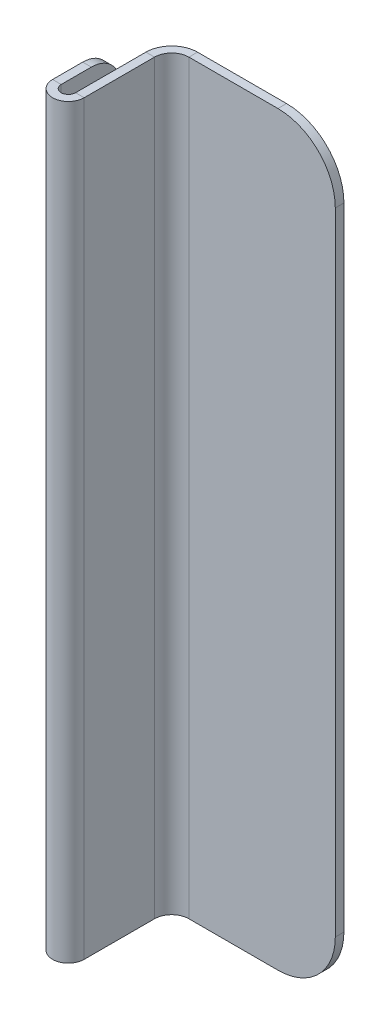
from build123d import *

# Parameters (mm, degrees)
IZIM1_W                      = 30
IZIM1_H                      = 130
TABAN_FLAN_1_DEPTH           = 1.5
RADYUS1_R                    = 10
KENAR_FLAN_1_STRIP_W         = 12
KENAR_FLAN_1_STRIP_H         = 1.5
KENAR_FLAN_1_STRIP_CUT_DEPTH = 130
KENAR_FLAN_1_DEPTH           = 130
KENAR_START                  = -53.051470588
KENAR_EKME1_DEPTH            = 130
KENAR_EKME1_2_DEPTH          = 130
RADYUS2_R                    = 5


# Read off the part's stored shape, not the designer's step: Kenar Çekme1
# Sheet-metal steps are written as plain solids
with BuildPart() as part:
    # Çizim1 → Taban-Flanş1 (new body)
    with BuildSketch(Plane.XY):
        with Locations((-32.781930006, 11.948529412)):
            Rectangle(IZIM1_W, IZIM1_H)
    extrude(amount=-TABAN_FLAN_1_DEPTH)

    # Radyus1
    radyus1_edges = [part.edges().sort_by_distance(p)[0] for p in [
        (-17.781930006, 76.948529412, -0.75),
        (-17.781930006, -53.051470588, -0.75),
    ]]
    fillet(radyus1_edges, radius=RADYUS1_R)

    # Kenar-Flanş1 strip (across the edge) → Kenar-Flanş1 strip cut (cut)
    with BuildSketch(Plane(origin=(-47.781930006, 76.948529412, 0), x_dir=(1, 0, 0), z_dir=(0, -1, 0))):
        with Locations((-1.5, -0.75)):
            Rectangle(KENAR_FLAN_1_STRIP_W, KENAR_FLAN_1_STRIP_H)
    extrude(amount=KENAR_FLAN_1_STRIP_CUT_DEPTH, mode=Mode.SUBTRACT)

    # Kenar-Flanş1 section (across the edge) → Kenar-Flanş1 (add)
    with BuildSketch(Plane(origin=(-47.781930006, 76.948529412, 0), x_dir=(1, 0, 0), z_dir=(0, -1, 0))):
        with BuildLine():
            Line((0, 3), (0, 18))
            Line((0, 18), (1.5, 18))
            Line((1.5, 18), (1.5, 3))
            ThreePointArc((1.5, 3), (2.378679656, 0.878679656), (4.5, 0))
            Line((4.5, 0), (4.5, -1.5))
            ThreePointArc((4.5, -1.5), (1.318019485, -0.181980515), (0, 3))
        make_face()
    extrude(amount=KENAR_FLAN_1_DEPTH)

    # Kenar Çekme1 outline → Kenar Çekme1 (cut)
    with BuildSketch(Plane(origin=(0, 0, 0), x_dir=(1, 0, 0), z_dir=(0, 1, 0)).offset(KENAR_START)):
        with BuildLine():
            ThreePointArc((-46.281930006, -15.25), (-46.686722126, -16.686140662), (-47.781930006, -17.699489743))
            Line((-47.781930006, -17.699489743), (-47.781930006, -18))
            Line((-47.781930006, -18), (-46.281930006, -18))
            Line((-46.281930006, -18), (-46.281930006, -15.25))
        make_face()
    extrude(amount=KENAR_EKME1_DEPTH, mode=Mode.SUBTRACT)

    # Kenar _ekme1 2 outline → Kenar _ekme1 2 (add)
    with BuildSketch(Plane(origin=(0, 0, 0), x_dir=(1, 0, 0), z_dir=(0, 1, 0)).offset(KENAR_START)):
        with BuildLine():
            Line((-50.281930006, -5), (-51.781930006, -5))
            Line((-51.781930006, -5), (-51.781930006, -15.25))
            ThreePointArc((-51.781930006, -15.25), (-50.468070668, -17.59520788), (-47.781930006, -17.699489743))
            Line((-47.781930006, -17.699489743), (-47.781930006, -15.25))
            ThreePointArc((-47.781930006, -15.25), (-49.031930006, -16.5), (-50.281930006, -15.25))
            Line((-50.281930006, -15.25), (-50.281930006, -5))
        make_face()
    extrude(amount=KENAR_EKME1_2_DEPTH)

    # Radyus2
    radyus2_edges = [part.edges().sort_by_distance(p)[0] for p in [
        (-51.031930006, 76.948529412, 5),
        (-51.031930006, -53.051470588, 5),
    ]]
    fillet(radyus2_edges, radius=RADYUS2_R)


solid = part.part
